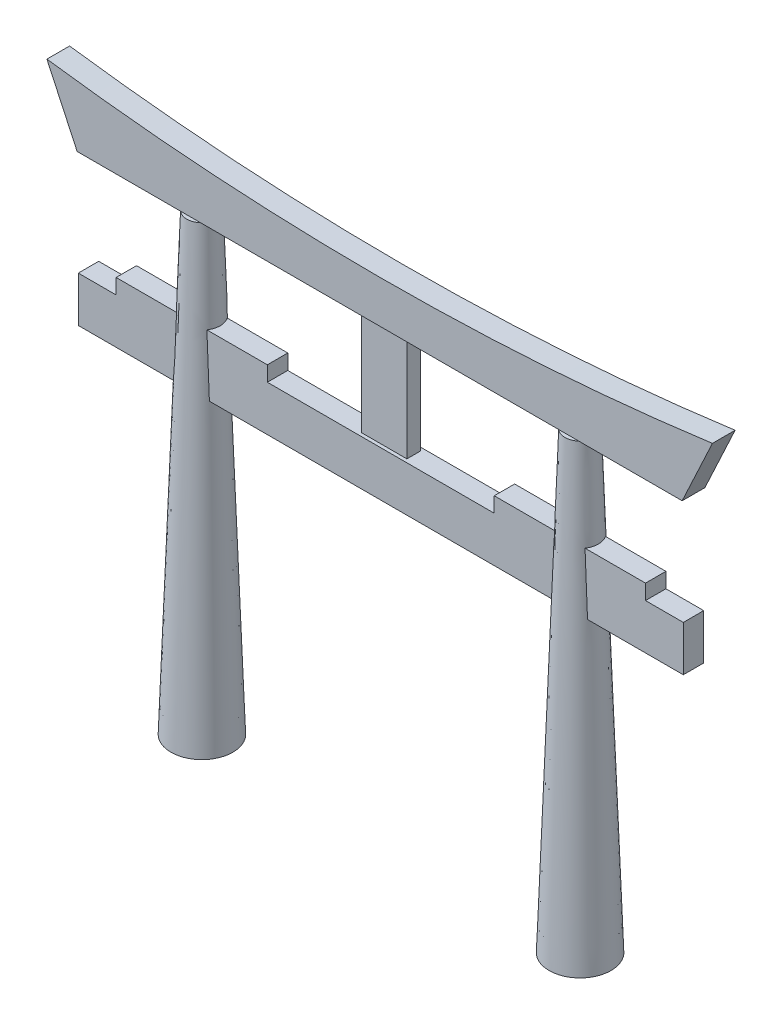
from build123d import *

# Parameters (mm, degrees)
SKETCH1_8_W         = 203.2
SKETCH1_8_H         = 15.24
SKETCH1_8_W_2       = 50.8
SKETCH1_8_H_2       = 5.08
BOSS_EXTRUDE1_DEPTH = 3.429
SKETCH1_9_W         = 15.24
SKETCH1_9_H         = 35.56
BOSS_EXTRUDE2_DEPTH = 2.286
BOSS_EXTRUDE3_DEPTH = 3.81


# Read off the part's stored shape, not the designer's step: Revolve-Thin2
with BuildPart() as part:
    # Revolve-Thin2 outline → Revolve-Thin2 (revolve)
    with BuildSketch(Plane(origin=(-63.5, 0, 0), x_dir=(1, 0, 0), z_dir=(0, 0, 1))):
        Polygon((0, 152.4), (0, 0), (10.401925271, 0), (5.08, 152.4), align=None)
        Polygon((2.54, 2.54), (2.54, 149.86), (2.627150512, 149.86), (7.771678274, 2.54), align=None, mode=Mode.SUBTRACT)
    revolve(axis=Axis((-63.5, 0, 0), (0, 1, 0)))



with BuildPart() as body_2:
    # Sketch1<4> → Revolve1 (revolve)
    with BuildSketch(Plane.XY):
        Polygon((53.098074729, 0), (63.5, 0), (63.5, 152.4), (58.42, 152.4), align=None)
    revolve(axis=Axis((63.5, 0, 0), (0, 1, 0)))


with BuildPart() as body_3:
    # Sketch1<8> → Boss-Extrude1 (new, symmetric)
    with BuildSketch(Plane.XY):
        with Locations((0, 109.22)):
            Rectangle(SKETCH1_8_W, SKETCH1_8_H)
        with Locations((63.5, 119.38)):
            Rectangle(SKETCH1_8_W_2, SKETCH1_8_H_2)
        with Locations((-63.5, 119.38)):
            Rectangle(SKETCH1_8_W_2, SKETCH1_8_H_2)
    extrude(amount=BOSS_EXTRUDE1_DEPTH, both=True)

    # Sketch1<9> → Boss-Extrude2 (add, symmetric)
    with BuildSketch(Plane.XY):
        with Locations((0, 134.62)):
            Rectangle(SKETCH1_9_W, SKETCH1_9_H)
    extrude(amount=BOSS_EXTRUDE2_DEPTH, both=True)


with BuildPart() as part_1:
    add(part.part)

    add(body_2.part)  # Boss-Extrude3 merges body 2

    add(body_3.part)  # Boss-Extrude3 merges body 3
    # Sketch3 → Boss-Extrude3 (add, symmetric)
    with BuildSketch(Plane.XY):
        with BuildLine():
            Line((-101.6, 152.4), (101.6, 152.4))
            Line((101.6, 152.4), (111.76, 174.188190312))
            ThreePointArc((111.76, 174.188190312), (0, 166.616423921), (-111.76, 174.188190312))
            Line((-111.76, 174.188190312), (-101.6, 152.4))
        make_face()
    extrude(amount=BOSS_EXTRUDE3_DEPTH, both=True)


solid = part_1.part
